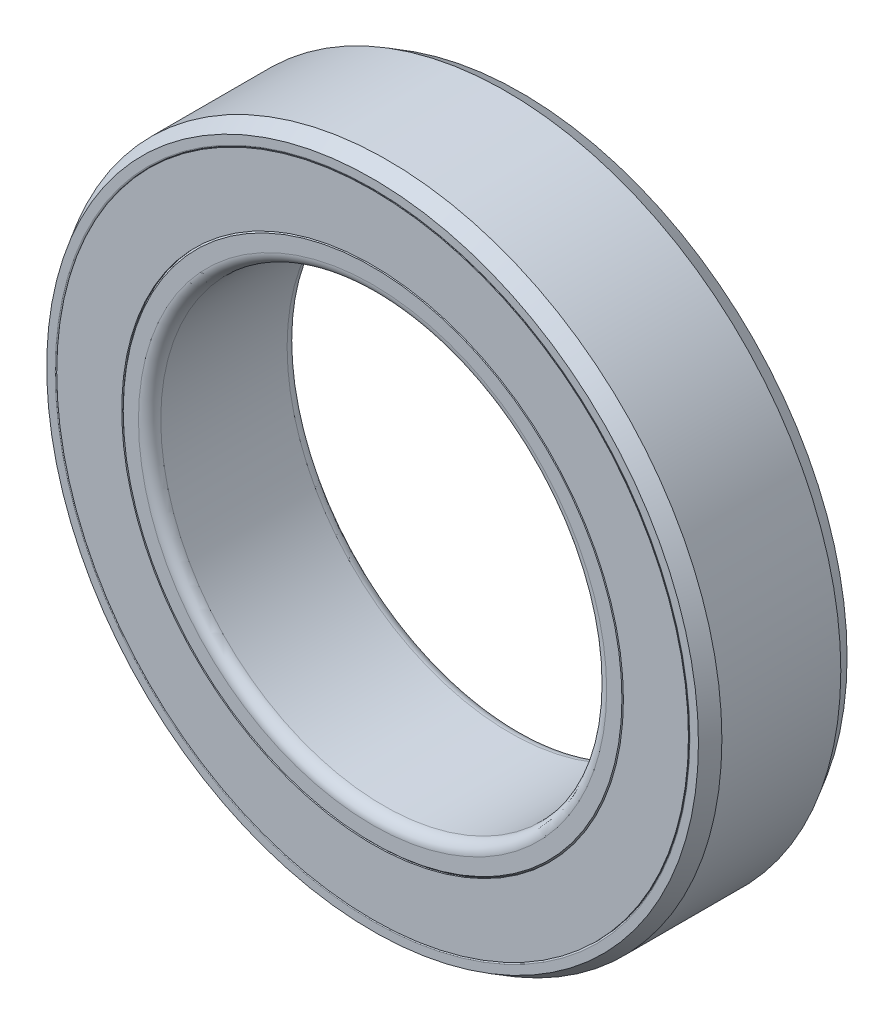
from build123d import *

# Parameters (mm, degrees)
SKETCH4_W         = 0.59375
SKETCH4_H         = 1.75
CIRPATTERN1_COUNT = 7


with BuildPart() as part:
    # Sketch3 → Revolve1 (revolve)
    with BuildSketch(Plane(origin=(0, 0, 0), x_dir=(0, 0, -1), z_dir=(1, 0, 0))):
        with BuildLine():
            Line((-1.6, -9), (1.6, -9))
            Line((1.6, -9), (2, -8.769059892))
            Line((2, -8.769059892), (2, -8.54))
            ThreePointArc((2, -8.54), (1.988284271, -8.511715729), (1.96, -8.5))
            Line((1.96, -8.5), (0.833333333, -8.5))
            ThreePointArc((0.833333333, -8.5), (0, -8.833333333), (-0.833333333, -8.5))
            Line((-0.833333333, -8.5), (-1.96, -8.5))
            ThreePointArc((-1.96, -8.5), (-1.988284271, -8.511715729), (-2, -8.54))
            Line((-2, -8.54), (-2, -8.769059892))
            Line((-2, -8.769059892), (-1.6, -9))
        make_face()
        with BuildLine():
            Line((-1.7, -6), (1.7, -6))
            ThreePointArc((1.7, -6), (1.912132034, -6.087867966), (2, -6.3))
            Line((2, -6.3), (2, -6.71))
            Line((2, -6.71), (1.96, -6.75))
            Line((1.96, -6.75), (0.833333333, -6.75))
            ThreePointArc((0.833333333, -6.75), (0, -6.416666667), (-0.833333333, -6.75))
            Line((-0.833333333, -6.75), (-1.96, -6.75))
            Line((-1.96, -6.75), (-2, -6.71))
            Line((-2, -6.71), (-2, -6.3))
            ThreePointArc((-2, -6.3), (-1.912132034, -6.087867966), (-1.7, -6))
        make_face()
    revolve(axis=Axis((0, 0, 2), (0, 0, -1)))


with BuildPart() as body_2:
    # Sketch4 → Revolve2 (revolve)
    with BuildSketch(Plane(origin=(0, 0, 0), x_dir=(0, 0, -1), z_dir=(1, 0, 0))):
        with Locations((-1.703125, -7.625)):
            Rectangle(SKETCH4_W, SKETCH4_H)
    revolve(axis=Axis((0, 0, 2), (0, 0, -1)))


with BuildPart() as body_3:
    # Sketch5 → Revolve3 (revolve)
    with BuildSketch(Plane(origin=(0, 0, 0), x_dir=(0, 0, -1), z_dir=(1, 0, 0))):
        with BuildLine():
            Line((0, -6.416666667), (0, -8.833333333))
            ThreePointArc((0, -8.833333333), (-1.208333333, -7.625), (0, -6.416666667))
        make_face()
    revolve(axis=Axis((0, 0, 0), (0, -1, 0)))


with BuildPart() as cirpattern1_1:
    # CirPattern1: pattern copy
    add(body_3.part.rotate(Axis((0, 0, 2), (0, 0, -1)), 1 * 360 / CIRPATTERN1_COUNT))


with BuildPart() as cirpattern1_2:
    # CirPattern1: pattern copy
    add(body_3.part.rotate(Axis((0, 0, 2), (0, 0, -1)), 2 * 360 / CIRPATTERN1_COUNT))


with BuildPart() as cirpattern1_3:
    # CirPattern1: pattern copy
    add(body_3.part.rotate(Axis((0, 0, 2), (0, 0, -1)), 3 * 360 / CIRPATTERN1_COUNT))


with BuildPart() as cirpattern1_4:
    # CirPattern1: pattern copy
    add(body_3.part.rotate(Axis((0, 0, 2), (0, 0, -1)), 4 * 360 / CIRPATTERN1_COUNT))


with BuildPart() as cirpattern1_5:
    # CirPattern1: pattern copy
    add(body_3.part.rotate(Axis((0, 0, 2), (0, 0, -1)), 5 * 360 / CIRPATTERN1_COUNT))


with BuildPart() as cirpattern1_6:
    # CirPattern1: pattern copy
    add(body_3.part.rotate(Axis((0, 0, 2), (0, 0, -1)), 6 * 360 / CIRPATTERN1_COUNT))


solid = Compound([part.part, body_2.part, body_3.part, cirpattern1_1.part, cirpattern1_2.part, cirpattern1_3.part, cirpattern1_4.part, cirpattern1_5.part, cirpattern1_6.part])
